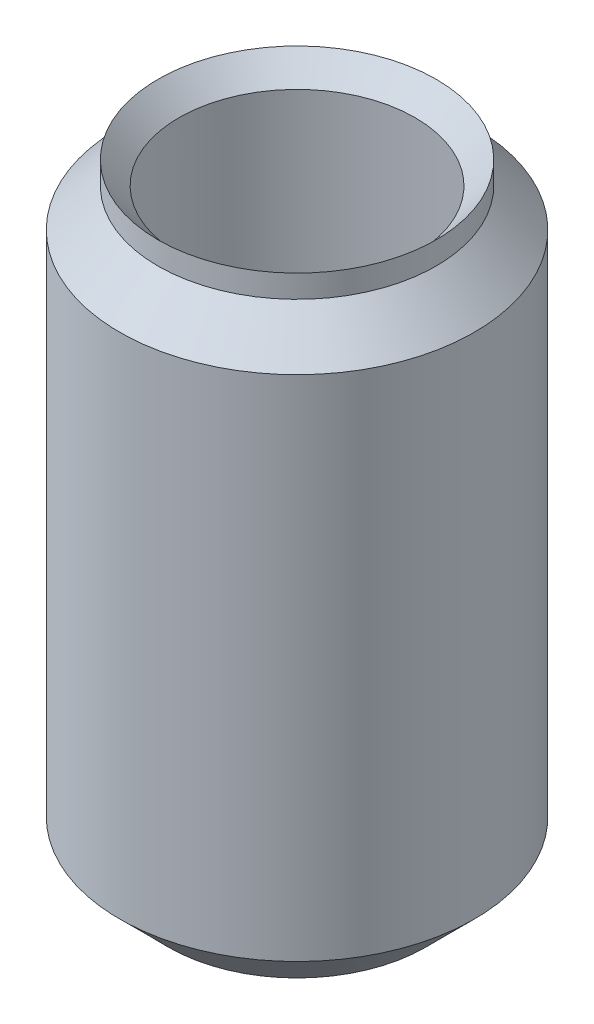
from build123d import *


# Read off the part's stored shape, not the designer's step: Coque1
with BuildPart() as part:
    # Esquisse2 → Révolution1 (revolve)
    with BuildSketch(Plane.XY, mode=Mode.PRIVATE) as r_volution1_sk:
        with BuildLine():
            Line((-13.898458102, 54.040241613), (-35.734472287, 54.040241613))
            Line((-35.734472287, 54.040241613), (-39.62739029, 58.240241613))
            Line((-39.62739029, 58.240241613), (-39.62739029, 54.040241613))
            Line((-39.62739029, 54.040241613), (-46.698458102, 46.969173801))
            Line((-46.698458102, 46.969173801), (-46.698458102, -47.030826199))
            Line((-46.698458102, -47.030826199), (-37.698458102, -56.030826199))
            Line((-37.698458102, -56.030826199), (-37.653902917, -55.957591814))
            ThreePointArc((-37.653902917, -55.957591814), (-30.368059552, -48.918535602), (-20.567624939, -46.352739954))
            Line((-20.567624939, -46.352739954), (-13.898458102, -46.352739954))
            Line((-13.898458102, -46.352739954), (-13.898458102, 54.040241613))
        make_face()
    revolve(r_volution1_sk.sketch.rotate(Axis((-13.898458102, -46.352739954, 0), (0, 1, 0)), 270), axis=Axis((-13.898458102, -46.352739954, 0), (0, 1, 0)))

    # Coque1 outline → Coque1 (revolve, cut)
    with BuildSketch(Plane(origin=(-13.898458102, 0, 0), x_dir=(1, 0, 0), z_dir=(0, 0, 1))):
        with BuildLine():
            Line((21.985998539, 54.040241613), (0, 54.040241613))
            Line((0, 54.040241613), (0, -46.242739954))
            Line((0, -46.242739954), (6.669166837, -46.242739954))
            ThreePointArc((6.669166837, -46.242739954), (16.499847403, -48.809370278), (23.821157224, -55.854105483))
            Line((23.821157224, -55.854105483), (32.69, -46.985262707))
            Line((32.69, -46.985262707), (32.69, 46.92361031))
            Line((32.69, 46.92361031), (25.618932188, 53.994678121))
            Line((25.618932188, 53.994678121), (25.618932188, 57.959749117))
            Line((25.618932188, 57.959749117), (21.985998539, 54.040241613))
        make_face()
    revolve(axis=Axis((-13.898458102, 0, 0), (0, 1, 0)), mode=Mode.SUBTRACT)


solid = part.part
